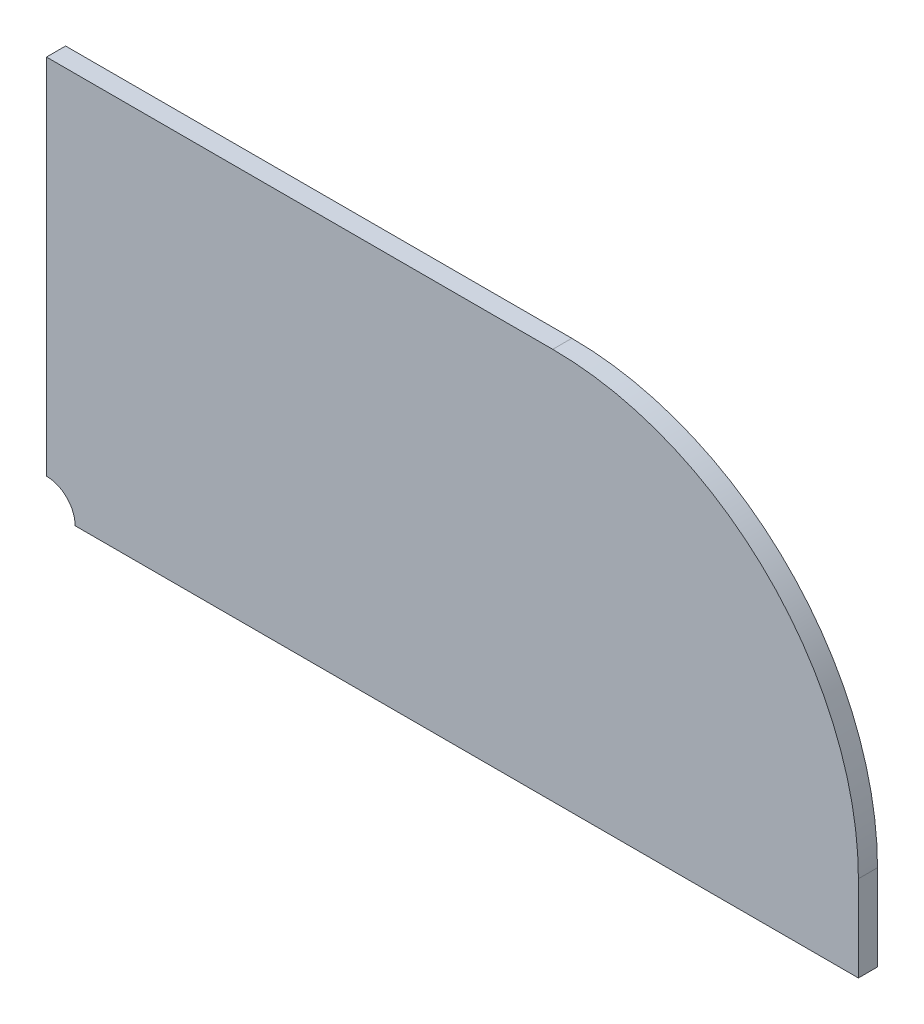
from build123d import *

# Parameters (mm, degrees)
BASE_FLANGE1_DEPTH = 1


# Sheet-metal steps are written as plain solids
with BuildPart() as part:
    # Sketch1 → Base-Flange1 (new body)
    with BuildSketch(Plane.XY):
        with BuildLine():
            Line((42.5, 4.5), (42.5, 0))
            Line((42.5, 0), (1.5, 0))
            ThreePointArc((1.5, 0), (1.060660172, 1.060660172), (0, 1.5))
            Line((0, 1.5), (0, 20.5))
            Line((0, 20.5), (26.5, 20.5))
            ThreePointArc((26.5, 20.5), (37.813708499, 15.813708499), (42.5, 4.5))
        make_face()
    extrude(amount=-BASE_FLANGE1_DEPTH)


solid = part.part
